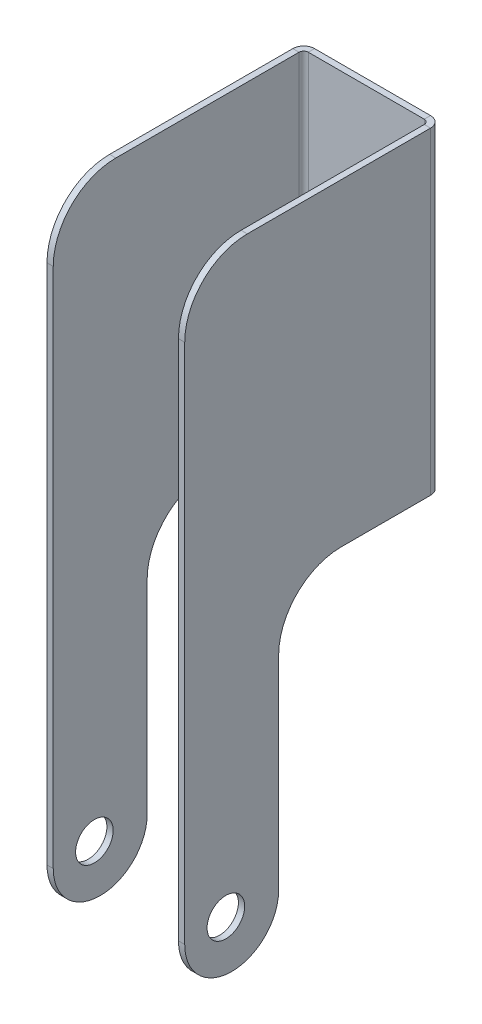
from build123d import *

# Parameters (mm, degrees)
CROQUIS1_W                         = 20
CROQUIS1_H                         = 50.8
BRIDA_BASE1_DEPTH                  = 1
BRIDA_DE_ARISTA1_STRIP_W           = 5.4732
BRIDA_DE_ARISTA1_STRIP_H           = 1
BRIDA_DE_ARISTA1_STRIP_CUT_DEPTH   = 50.8
BRIDA_DE_ARISTA1_STRIP_2_W         = 5.4732
BRIDA_DE_ARISTA1_STRIP_2_H         = 1
BRIDA_DE_ARISTA1_STRIP_CUT_2_DEPTH = 50.8
BRIDA_DE_ARISTA1_DEPTH             = 50.8
BRIDA_DE_ARISTA1_BEND_DEPTH        = 50.8
CROQUIS14_W                        = 15
CROQUIS14_H                        = 50
PESTA_A1_DEPTH                     = 1
CROQUIS17_R                        = 3
CORTAR_EXTRUIR1_DEPTH              = 89.14283862
REDONDEO1_R                        = 10
REDONDEO2_R                        = 7.5


# Sheet-metal steps are written as plain solids
with BuildPart() as part:
    # Croquis1 → Brida base1 (new body)
    with BuildSketch(Plane.XY):
        Rectangle(CROQUIS1_W, CROQUIS1_H)
    extrude(amount=-BRIDA_BASE1_DEPTH)

    # Brida de arista1 strip (across the edge) → Brida de arista1 strip cut (cut)
    with BuildSketch(Plane(origin=(-10, 25.4, 0), x_dir=(1, 0, 0), z_dir=(0, -1, 0))):
        with Locations((-2, -0.5)):
            Rectangle(BRIDA_DE_ARISTA1_STRIP_W, BRIDA_DE_ARISTA1_STRIP_H)
    extrude(amount=BRIDA_DE_ARISTA1_STRIP_CUT_DEPTH, mode=Mode.SUBTRACT)

    # Brida de arista1 strip 2 (across the edge) → Brida de arista1 strip cut 2 (cut)
    with BuildSketch(Plane(origin=(10, -25.4, 0), x_dir=(-1, 0, 0), z_dir=(0, 1, 0))):
        with Locations((-2, -0.5)):
            Rectangle(BRIDA_DE_ARISTA1_STRIP_2_W, BRIDA_DE_ARISTA1_STRIP_2_H)
    extrude(amount=BRIDA_DE_ARISTA1_STRIP_CUT_2_DEPTH, mode=Mode.SUBTRACT)

    # Brida de arista1 section (across the edge) → Brida de arista1 (add)
    with BuildSketch(Plane(origin=(-10, 25.4, 0), x_dir=(1, 0, 0), z_dir=(0, -1, 0))):
        with BuildLine():
            Line((-1, 0.7366), (-1, 40))
            Line((-1, 40), (0, 40))
            Line((0, 40), (0, 0.7366))
            ThreePointArc((0, 0.7366), (0.215745145, 0.215745145), (0.7366, 0))
            Line((0.7366, 0), (0.7366, -1))
            ThreePointArc((0.7366, -1), (-0.491361636, -0.491361636), (-1, 0.7366))
        make_face()
    extrude(amount=BRIDA_DE_ARISTA1_DEPTH)

    # Brida de arista1 section 2 (across the edge) → Brida de arista1 bend (add)
    with BuildSketch(Plane(origin=(10, -25.4, 0), x_dir=(-1, 0, 0), z_dir=(0, 1, 0))):
        with BuildLine():
            Line((-1, 0.7366), (-1, 40))
            Line((-1, 40), (0, 40))
            Line((0, 40), (0, 0.7366))
            ThreePointArc((0, 0.7366), (0.215745145, 0.215745145), (0.7366, 0))
            Line((0.7366, 0), (0.7366, -1))
            ThreePointArc((0.7366, -1), (-0.491361636, -0.491361636), (-1, 0.7366))
        make_face()
    extrude(amount=BRIDA_DE_ARISTA1_BEND_DEPTH)

    # Croquis14 → Pestaña1 (add)
    with BuildSketch(Plane.ZY.offset(11)):
        with Locations((32.5, -50.4)):
            Rectangle(CROQUIS14_W, CROQUIS14_H)
    pesta_a1 = extrude(amount=-PESTA_A1_DEPTH)

    # Simetría1: Pestaña1 across plane
    add(pesta_a1.mirror(Plane(origin=(0, 0, 0), x_dir=(0, 0, 1), z_dir=(1, 0, 0))))

    # Croquis17 → Cortar-Extruir1 (cut, through all)
    with BuildSketch(Plane.ZY.offset(11)):
        with Locations((33.4285, -67.4)):
            Circle(CROQUIS17_R)
    extrude(amount=-CORTAR_EXTRUIR1_DEPTH, mode=Mode.SUBTRACT)

    # Redondeo1
    redondeo1_edges = [part.edges().sort_by_distance(p)[0] for p in [
        (-10.5, 25.4, 40),
        (10.5, 25.4, 40),
        (-10.5, -25.4, 25),
        (10.5, -25.4, 25),
    ]]
    fillet(redondeo1_edges, radius=REDONDEO1_R)

    # Redondeo2
    redondeo2_edges = [part.edges().sort_by_distance(p)[0] for p in [
        (10.5, -75.4, 25),
        (10.5, -75.4, 40),
        (-10.5, -75.4, 25),
        (-10.5, -75.4, 40),
    ]]
    fillet(redondeo2_edges, radius=REDONDEO2_R - 0.0001)  # a hair under: the kernel refuses the full size


solid = part.part
